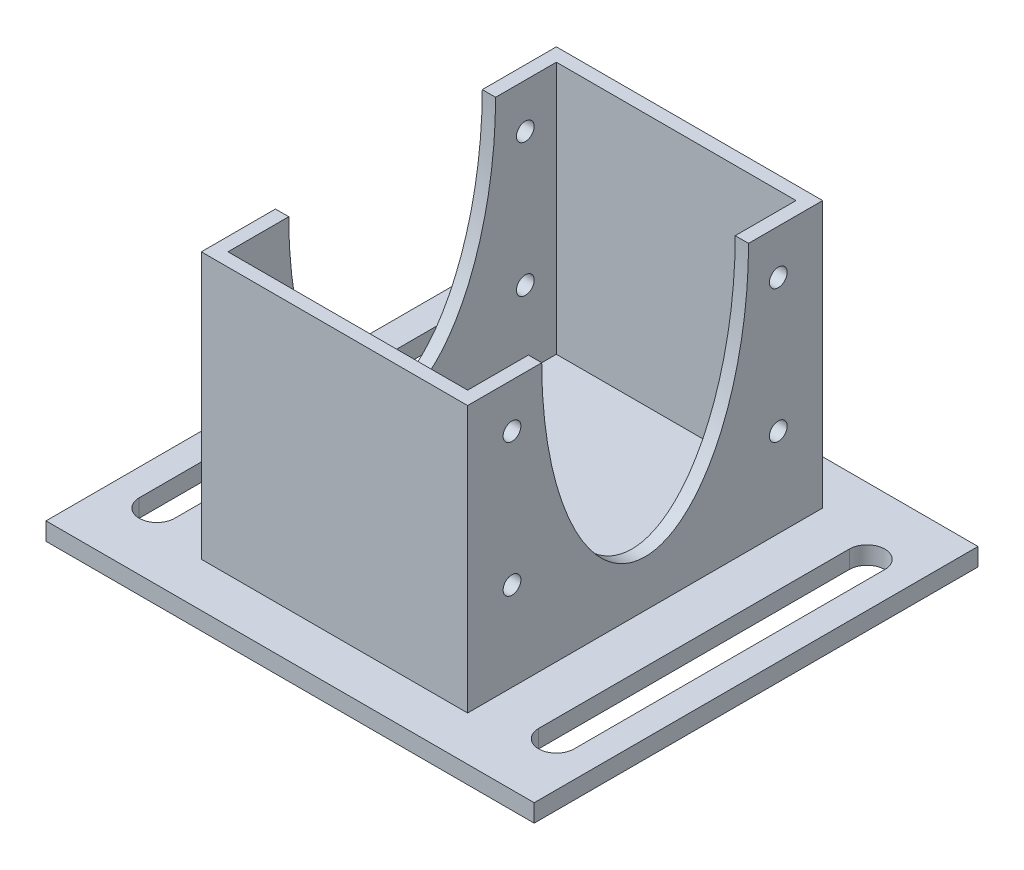
from build123d import *
from build123d.topology import SkipClean

# Parameters (mm, degrees)
SKETCH1_W           = 76.2
SKETCH1_H           = 101.6
BOSS_EXTRUDE1_DEPTH = 76.2
SKETCH2_RX          = 62.8740047
SKETCH2_RY          = 29.591838086
CUT_EXTRUDE1_DEPTH  = 120.1365603
SHELL1_T            = -3.81
SKETCH4_R           = 2.54
CUT_EXTRUDE2_DEPTH  = 120.13656047
SKETCH5_W           = 139.7
SKETCH5_H           = 127
BOSS_EXTRUDE2_DEPTH = 5.08
CUT_EXTRUDE3_DEPTH  = 122.316579721


with BuildPart() as part:
    # Sketch1 → Boss-Extrude1 (new body)
    with BuildSketch(Plane(origin=(0, 0, 0), x_dir=(1, 0, 0), z_dir=(0, 1, 0))):
        Rectangle(SKETCH1_W, SKETCH1_H)
    extrude(amount=BOSS_EXTRUDE1_DEPTH)

    # Sketch2 → Cut-Extrude1 (cut, through all)
    with SkipClean():  # the faces are left unmerged after this step: merging them gives an invalid solid
        with BuildSketch(Plane.ZY.offset(38.1)):
            with Locations(Location((0, 76.2), (0, 0, -90))):
                Ellipse(SKETCH2_RX, SKETCH2_RY)
        extrude(amount=-CUT_EXTRUDE1_DEPTH, mode=Mode.SUBTRACT)
    add(part.part.scale(1), mode=Mode.REPLACE)  # the faces are merged on a copy

    # Shell1
    shell1_openings = [part.faces().sort_by_distance(p)[0] for p in [
        (0, 76.2, -40.195919043),
        (0, 31.741364916, -20.924589378),
        (0, 31.741364916, 20.924589378),
        (0, 76.2, 40.195919043),
    ]]
    offset(amount=SHELL1_T, openings=shell1_openings, kind=Kind.INTERSECTION)

    # Sketch4 → Cut-Extrude2 (cut, through all)
    with BuildSketch(Plane.ZY.offset(38.1)):
        with Locations((-38.1, 63.5)):
            Circle(SKETCH4_R)
        with Locations((-38.1, 25.4)):
            Circle(SKETCH4_R)
        with Locations(Location((38.1, 25.4, 0), (0, 0, 180))):
            Circle(SKETCH4_R)
        with Locations(Location((38.1, 63.5, 0), (0, 0, 180))):
            Circle(SKETCH4_R)
    extrude(amount=-CUT_EXTRUDE2_DEPTH, mode=Mode.SUBTRACT)

    # Sketch5 → Boss-Extrude2 (add)
    with BuildSketch(Plane.XZ):
        Rectangle(SKETCH5_W, SKETCH5_H)
    extrude(amount=BOSS_EXTRUDE2_DEPTH)

    # Sketch6 → Cut-Extrude3 (cut, through all)
    with BuildSketch(Plane(origin=(0, 0, 0), x_dir=(1, 0, 0), z_dir=(0, 1, 0))):
        with BuildLine():
            Line((-52.07, 44.45), (-52.07, -44.45))
            ThreePointArc((-52.07, -44.45), (-57.15, -49.53), (-62.23, -44.45))
            Line((-62.23, -44.45), (-62.23, 44.45))
            ThreePointArc((-62.23, 44.45), (-57.15, 49.53), (-52.07, 44.45))
        make_face()
        with BuildLine():
            Line((52.07, 44.45), (52.07, -44.45))
            ThreePointArc((52.07, -44.45), (57.15, -49.53), (62.23, -44.45))
            Line((62.23, -44.45), (62.23, 44.45))
            ThreePointArc((62.23, 44.45), (57.15, 49.53), (52.07, 44.45))
        make_face()
    extrude(amount=-CUT_EXTRUDE3_DEPTH, mode=Mode.SUBTRACT)


solid = part.part
